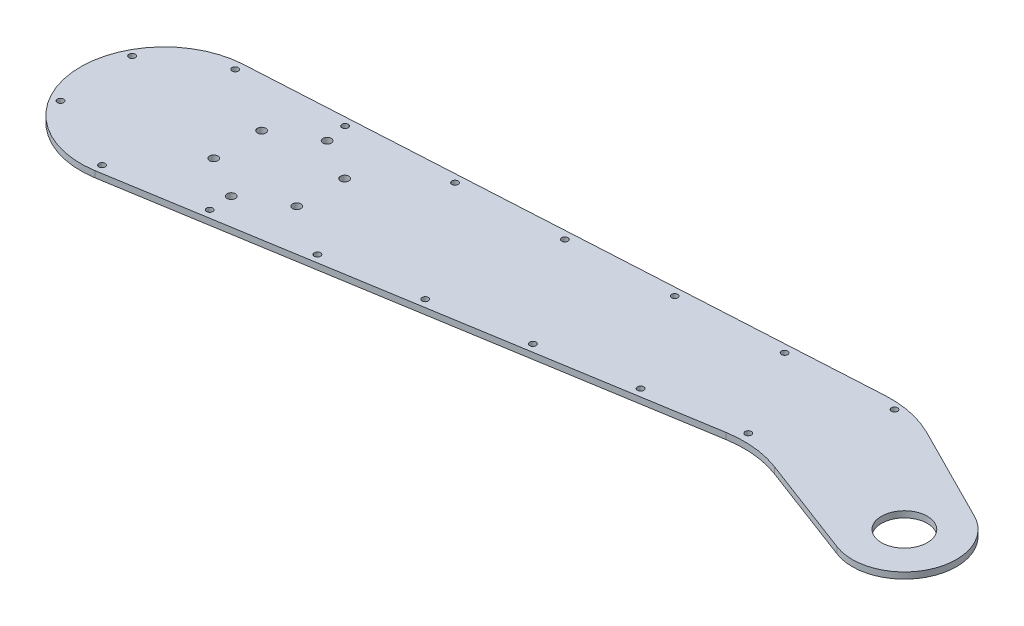
from build123d import *

# Parameters (mm, degrees)
SKETCH1_R           = 2
SKETCH1_R_2         = 11
BOSS_EXTRUDE2_DEPTH = 3
FILLET1_R           = 50
SKETCH2_R           = 1.5
CUT_EXTRUDE1_DEPTH  = 10


with BuildPart() as part:
    # Sketch1 → Boss-Extrude2 (new body)
    with BuildSketch(Plane(origin=(0, 0, 0), x_dir=(1, 0, 0), z_dir=(0, 1, 0))):
        with BuildLine():
            Line((-43.210033531, -45.078612162), (230.077464987, -0.308197366))
            Line((230.077464987, -0.308197366), (291.16461822, -23.386663481))
            ThreePointArc((291.16461822, -23.386663481), (322.884028765, -10.065844598), (311.267854408, 22.316708024))
            Line((311.267854408, 22.316708024), (252.97547919, 51.748916229))
            Line((252.97547919, 51.748916229), (-51.951129031, 34.644890888))
            ThreePointArc((-51.951129031, 34.644890888), (-89.620314745, -9.826208081), (-43.210033531, -45.078612162))
        make_face()
        with Locations((0, 23)):
            Circle(SKETCH1_R, mode=Mode.SUBTRACT)
        with Locations((0, -23)):
            Circle(SKETCH1_R, mode=Mode.SUBTRACT)
        with Locations((-19.918584287, -11.5)):
            Circle(SKETCH1_R, mode=Mode.SUBTRACT)
        with Locations((19.918584287, -11.5)):
            Circle(SKETCH1_R, mode=Mode.SUBTRACT)
        with Locations((-19.918584287, 11.5)):
            Circle(SKETCH1_R, mode=Mode.SUBTRACT)
        with Locations((19.918584287, 11.5)):
            Circle(SKETCH1_R, mode=Mode.SUBTRACT)
        with Locations((300, 0)):
            Circle(SKETCH1_R_2, mode=Mode.SUBTRACT)
    extrude(amount=BOSS_EXTRUDE2_DEPTH)

    # Fillet1
    fillet1_edges = [part.edges().sort_by_distance(p)[0] for p in [
        (230.077464987, 1.5, 0.308197366),
        (252.97547919, 1.5, -51.748916229),
    ]]
    fillet(fillet1_edges, radius=FILLET1_R)

    # Sketch2 → Cut-Extrude1 (cut)
    with BuildSketch(Plane(origin=(0, 3, 0), x_dir=(1, 0, 0), z_dir=(0, 1, 0))):
        with Locations((-51.727112095, 30.651168763)):
            Circle(SKETCH2_R)
        with Locations((-43.856700198, -41.13123047)):
            Circle(SKETCH2_R)
        with Locations((-80.543038085, -24.356685052)):
            Circle(SKETCH2_R)
        with Locations((-82.014474694, 11.465683169)):
            Circle(SKETCH2_R)
        with Locations((-1.805585532, 33.451380461)):
            Circle(SKETCH2_R)
        with Locations((48.115941032, 36.251592159)):
            Circle(SKETCH2_R)
        with Locations((98.037467596, 39.051803857)):
            Circle(SKETCH2_R)
        with Locations((147.958994159, 41.852015556)):
            Circle(SKETCH2_R)
        with Locations((197.880520723, 44.652227254)):
            Circle(SKETCH2_R)
        with Locations((247.802047287, 47.452438952)):
            Circle(SKETCH2_R)
        with Locations((0.551343837, -33.85623047)):
            Circle(SKETCH2_R)
        with Locations((44.959387872, -26.58123047)):
            Circle(SKETCH2_R)
        with Locations((89.367431907, -19.30623047)):
            Circle(SKETCH2_R)
        with Locations((133.775475942, -12.03123047)):
            Circle(SKETCH2_R)
        with Locations((178.183519977, -4.75623047)):
            Circle(SKETCH2_R)
        with Locations((222.591564011, 2.51876953)):
            Circle(SKETCH2_R)
    extrude(amount=-CUT_EXTRUDE1_DEPTH, mode=Mode.SUBTRACT)


solid = part.part
